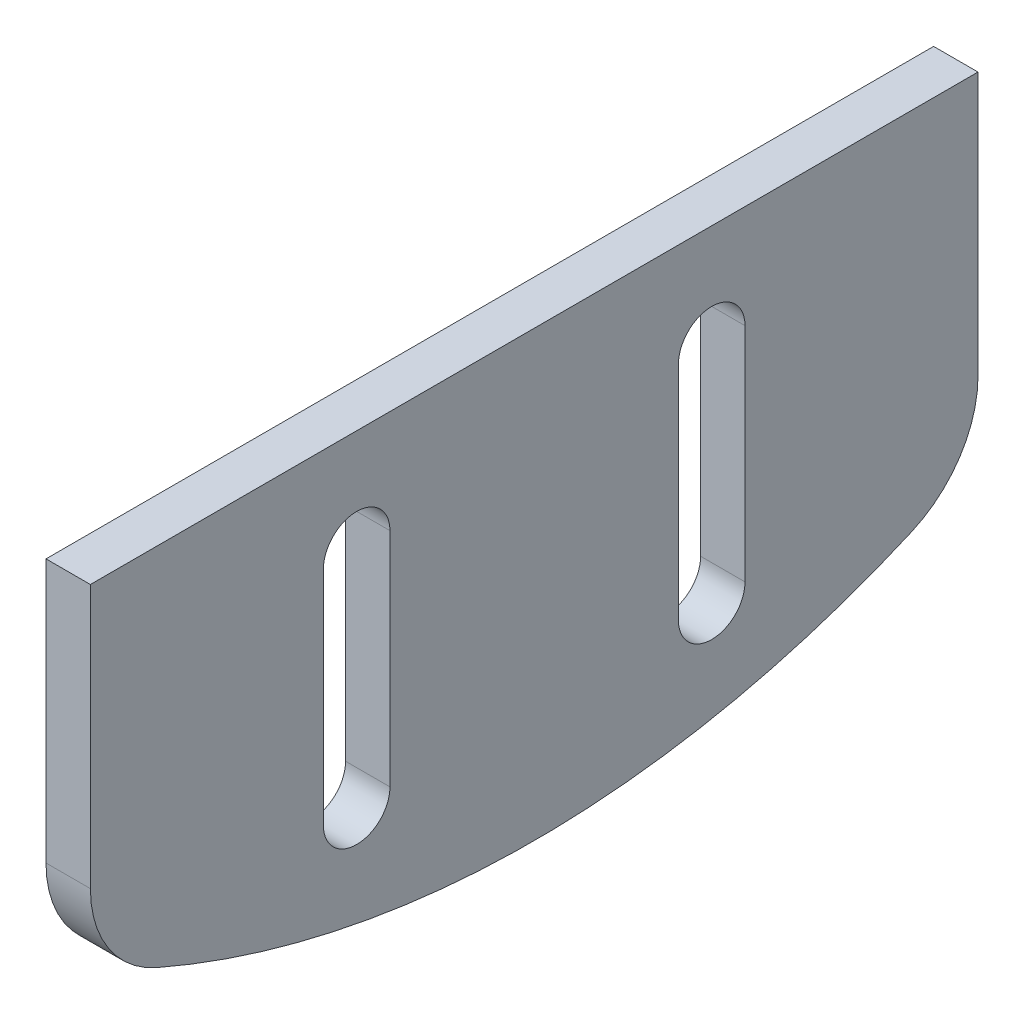
from build123d import *

# Parameters (mm, degrees)
EXTRUDE_1_DEPTH     = 2
CUT_EXTRUDE_1_DEPTH = 2
FILLET_1_R          = 5


with BuildPart() as part:
    # 草图1 → 凸台-拉伸1 (new body)
    with BuildSketch(Plane(origin=(0, 0, 0), x_dir=(0, 0, -1), z_dir=(1, 0, 0))):
        with BuildLine():
            Line((-20, 5), (-20, 20))
            Line((-20, 20), (20, 20))
            Line((20, 20), (20, 5))
            ThreePointArc((20, 5), (0, 0), (-20, 5))
        make_face()
    extrude(amount=EXTRUDE_1_DEPTH)

    # 草图2 → 切除-拉伸1 (cut)
    with BuildSketch(Plane(origin=(2, 0, 0), x_dir=(0, 0, -1), z_dir=(1, 0, 0))):
        with BuildLine():
            Line((-9.5, 5.351648758), (-9.5, 15.351648758))
            ThreePointArc((-9.5, 15.351648758), (-8, 16.851648758), (-6.5, 15.351648758))
            Line((-6.5, 15.351648758), (-6.5, 5.351648758))
            ThreePointArc((-6.5, 5.351648758), (-8, 3.851648758), (-9.5, 5.351648758))
        make_face()
        with BuildLine():
            Line((9.5, 5.351648758), (9.5, 15.351648758))
            ThreePointArc((9.5, 15.351648758), (8, 16.851648758), (6.5, 15.351648758))
            Line((6.5, 15.351648758), (6.5, 5.351648758))
            ThreePointArc((6.5, 5.351648758), (8, 3.851648758), (9.5, 5.351648758))
        make_face()
    extrude(amount=-CUT_EXTRUDE_1_DEPTH, mode=Mode.SUBTRACT)

    # 圆角1
    fillet_1_edges = [part.edges().sort_by_distance(p)[0] for p in [
        (1, 5, 20),
        (1, 5, -20),
    ]]
    fillet(fillet_1_edges, radius=FILLET_1_R)


solid = part.part
